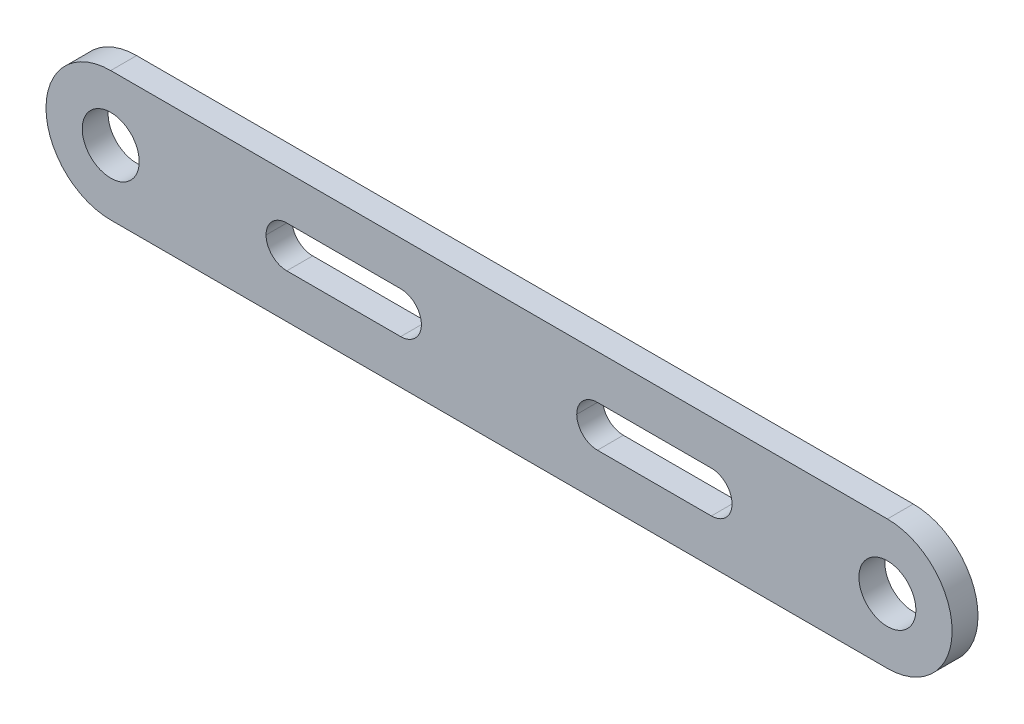
from build123d import *

# Parameters (mm, degrees)
SKETCH1_R           = 5.5
BOSS_EXTRUDE1_DEPTH = 5
SKETCH2_W           = 30
SKETCH2_H           = 8
CUT_EXTRUDE1_DEPTH  = 10
FILLET1_R           = 4


with BuildPart() as part:
    # Sketch1 → Boss-Extrude1 (new body)
    with BuildSketch(Plane.XY):
        with BuildLine():
            Line((75, 12.5), (-75, 12.5))
            ThreePointArc((-75, 12.5), (-87.5, 0), (-75, -12.5))
            Line((-75, -12.5), (75, -12.5))
            ThreePointArc((75, -12.5), (87.5, 0), (75, 12.5))
        make_face()
        with Locations((-75, 0)):
            Circle(SKETCH1_R, mode=Mode.SUBTRACT)
        with Locations(Location((75, 0, 0), (0, 0, 180))):
            Circle(SKETCH1_R, mode=Mode.SUBTRACT)
    extrude(amount=BOSS_EXTRUDE1_DEPTH)

    # Sketch2 → Cut-Extrude1 (cut)
    with BuildSketch(Plane(origin=(0, 0, 0), x_dir=(-1, 0, 0), z_dir=(0, 0, -1))):
        with Locations((-30, 0)):
            Rectangle(SKETCH2_W, SKETCH2_H)
        with Locations((30, 0)):
            Rectangle(SKETCH2_W, SKETCH2_H)
    extrude(amount=-CUT_EXTRUDE1_DEPTH, mode=Mode.SUBTRACT)

    # Fillet1
    fillet1_edges = [part.edges().sort_by_distance(p)[0] for p in [
        (15, -4, 2.5),
        (45, -4, 2.5),
        (45, 4, 2.5),
        (15, 4, 2.5),
        (-45, -4, 2.5),
        (-15, -4, 2.5),
        (-15, 4, 2.5),
        (-45, 4, 2.5),
    ]]
    fillet(fillet1_edges, radius=FILLET1_R - 0.0001)  # a hair under: the kernel refuses the full size


solid = part.part
